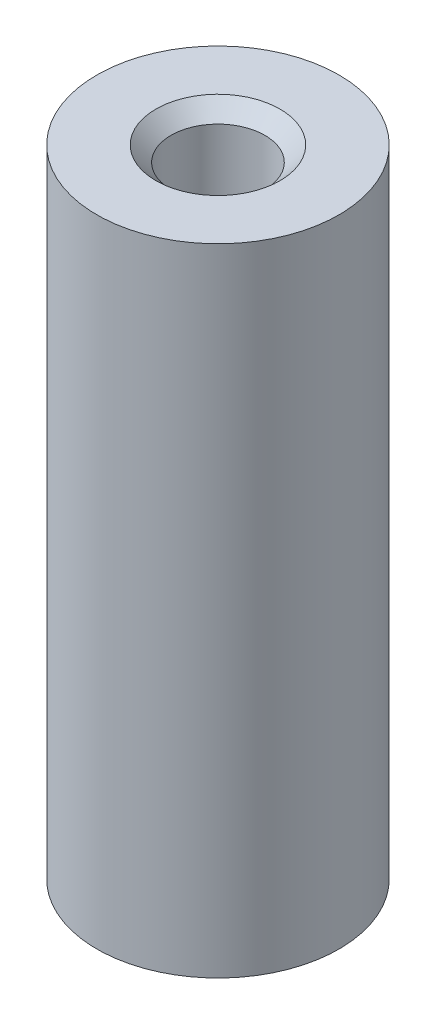
from build123d import *

# Parameters (mm, degrees)
SKIZZE1_R                        = 4
AUFSATZ_LINEAR_AUSTRAGEN1_DEPTH  = 21
F_3_1_3_1_DURCHMESSER_BOHRUNG1_D = 3.1
FASE1_SIZE                       = 0.5


with BuildPart() as part:
    # Skizze1 → Aufsatz-Linear austragen1 (new body)
    with BuildSketch(Plane(origin=(0, 0, 0), x_dir=(1, 0, 0), z_dir=(0, 1, 0))):
        Circle(SKIZZE1_R)
    extrude(amount=AUFSATZ_LINEAR_AUSTRAGEN1_DEPTH)

    # Ø3.1 (3.1) Durchmesser Bohrung1 (through all)
    with Locations(Plane(origin=(0, 21, 0), x_dir=(1, 0, 0), z_dir=(0, 1, 0))):
        with Locations((0, 0)):
            Hole(F_3_1_3_1_DURCHMESSER_BOHRUNG1_D / 2)

    # Fase1
    fase1_edges = [part.edges().sort_by_distance(p)[0] for p in [
        (1.55, 0, 0),
        (1.55, 21, 0),
    ]]
    chamfer(fase1_edges, length=FASE1_SIZE)


solid = part.part
